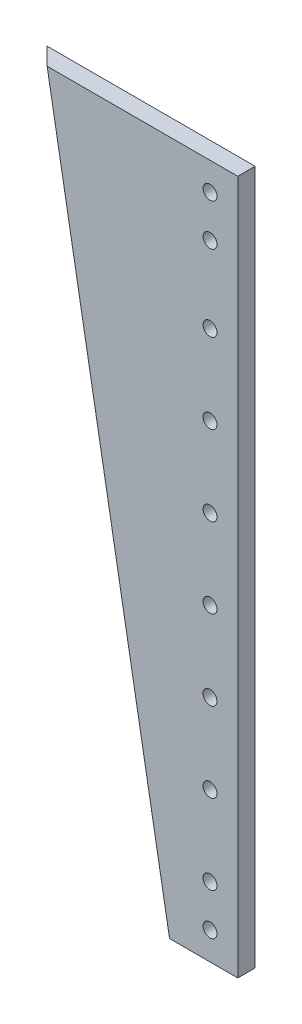
from build123d import *

# Parameters (mm, degrees)
SKETCH1_W              = 60
SKETCH1_H              = 200
BOSS_EXTRUDE1_DEPTH    = 5
SKETCH6_R              = 2
CUT_EXTRUDE3_DEPTH     = 5
SKETCH7_R              = 2
CUT_EXTRUDE4_DEPTH     = 5
LPATTERN1_COUNT        = 6
LPATTERN1_PITCH        = 23
CUT_EXTRUDE_1312_DEPTH = 5
CHAMFER_1373_SIZE      = 5


with BuildPart() as part:
    # Sketch1 → Boss-Extrude1 (new body)
    with BuildSketch(Plane.XY):
        with Locations((-30, 100)):
            Rectangle(SKETCH1_W, SKETCH1_H)
    extrude(amount=BOSS_EXTRUDE1_DEPTH)

    # Sketch6 → Cut-Extrude3 (cut)
    with BuildSketch(Plane.XY):
        with Locations((-8, 8)):
            Circle(SKETCH6_R)
        with Locations((-8, 20)):
            Circle(SKETCH6_R)
    cut_extrude3 = extrude(amount=CUT_EXTRUDE3_DEPTH, mode=Mode.SUBTRACT)

    # Mirror1: Cut-Extrude3 across plane
    add(cut_extrude3.mirror(Plane.ZX.offset(100)), mode=Mode.SUBTRACT)

    # Sketch7 → Cut-Extrude4 (cut)
    with BuildSketch(Plane.XY):
        with Locations((-8, 43)):
            Circle(SKETCH7_R)
    cut_extrude4 = extrude(amount=CUT_EXTRUDE4_DEPTH, mode=Mode.SUBTRACT)

    # LPattern1: Cut-Extrude4 ×6
    with Locations(*[(0, i * LPATTERN1_PITCH, 0) for i in range(1, LPATTERN1_COUNT)]):
        add(cut_extrude4, mode=Mode.SUBTRACT)

    # Sketch3 → Cut-Extrude 1312 (cut)
    with BuildSketch(Plane(origin=(-200, 0, 0), x_dir=(-1, 0, 0), z_dir=(0, 0, -1))):
        Polygon((-140, 0), (-175.265396142, 0), (-140, 200), align=None)
    extrude(amount=-CUT_EXTRUDE_1312_DEPTH, mode=Mode.SUBTRACT)

    # Chamfer 1373
    chamfer_1373_edges = [part.edges().sort_by_distance(p)[0] for p in [
        (-42.367301929, 100, 5),
    ]]
    chamfer(chamfer_1373_edges, length=CHAMFER_1373_SIZE - 0.0001)  # a hair under: the kernel refuses the full size


solid = part.part
